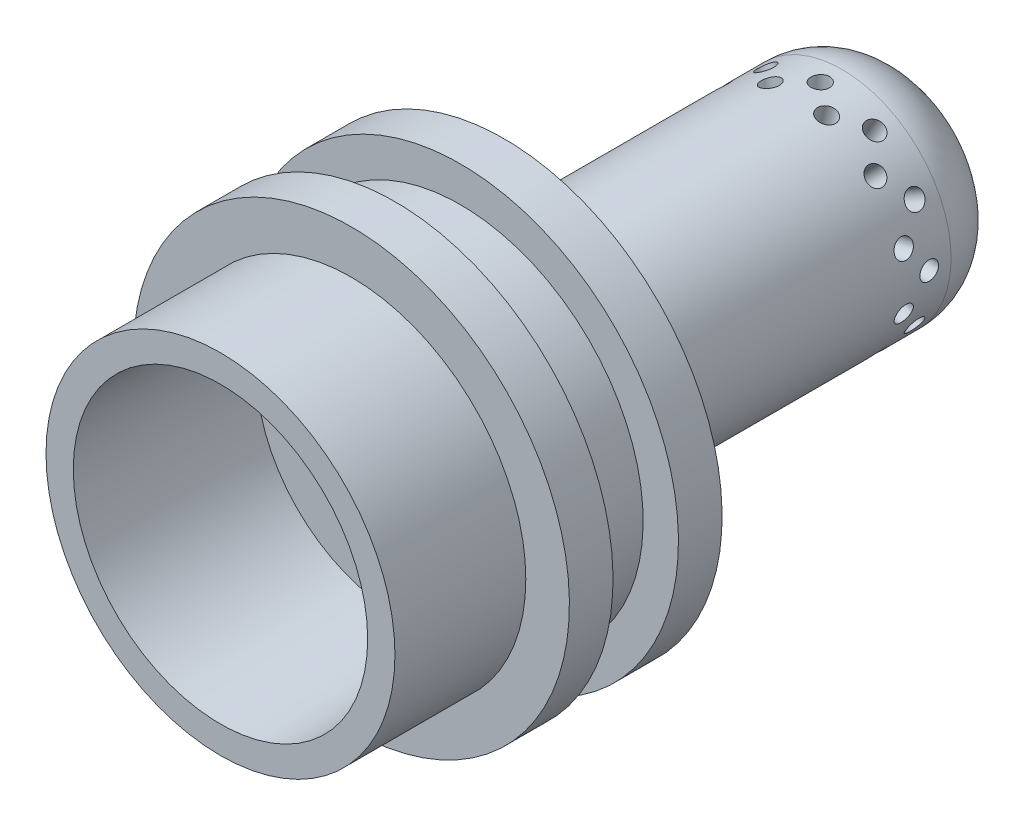
from build123d import *

# Parameters (mm, degrees)
ORIFICE_HOLE_R        = 0.543941
FORWARD_ORIFICE_DEPTH = 31.080506977
SKETCH7_R             = 0.543941
OFFSET_ORIFICE_DEPTH  = 31.080506977
ORIFICE_PATTERN_COUNT = 12
PINTLE_END_FILLET_R   = 3.81
PINTLE_START_FILLET_R = 3.175


# Read off the part's stored shape, not the designer's step: AdvancedHole1
with BuildPart() as part:
    # Sketch2 → Primary Revolve (revolve)
    with BuildSketch(Plane(origin=(0, 0, 0), x_dir=(0, 0, -1), z_dir=(1, 0, 0)), mode=Mode.PRIVATE) as primary_revolve_sk:
        Polygon((-7.62, 12.7), (-10.16, 12.7), (-10.16, 10.6426), (-13.97, 10.6426), (-13.97, 12.7), (-16.51, 12.7), (-16.51, 10.16), (-24.13, 10.16), (-24.13, 0), (15.875, 0), (15.875, 6.35), (-7.62, 6.35), align=None)
    revolve(primary_revolve_sk.sketch.rotate(Axis((0, 0, 24.13), (0, 0, -1)), 180), axis=Axis((0, 0, 24.13), (0, 0, -1)))

    # AdvancedHole1 outline → AdvancedHole1 (revolve, cut)
    with BuildSketch(Plane.XZ):
        Polygon((4.7625, 13.79982), (8.249999615, 13.79982), (8.5725, 24.13), (0, 24.13), (0, -14.2875), (4.7625, -11.425901302), align=None)
    revolve(axis=Axis((0, 0, 0), (0, 0, 1)), mode=Mode.SUBTRACT)

    # Orifice Hole → Forward Orifice (cut, through all)
    with BuildSketch(Plane(origin=(0, 0, 0), x_dir=(1, 0, 0), z_dir=(0, 1, 0))):
        with Locations(Location((0, 10.795, 0), (0, 0, 90))):
            Circle(ORIFICE_HOLE_R)
    forward_orifice = extrude(amount=FORWARD_ORIFICE_DEPTH, mode=Mode.SUBTRACT)

    # Sketch7 → Offset Orifice (cut, through all)
    with BuildSketch(Plane(origin=(0, 0, 0), x_dir=(0, 0, 1), z_dir=(0.25881904510252135, 0.9659258262890681, 0))):
        with Locations(Location((-9.525, 0, 0), (0, 0, 90))):
            Circle(SKETCH7_R)
    offset_orifice = extrude(amount=OFFSET_ORIFICE_DEPTH, mode=Mode.SUBTRACT)

    # Orifice Pattern: Forward Orifice, Offset Orifice ×12 about axis
    orifice_pattern_axis = Axis((0, 0, -16.07764641), (0, 0, 1))
    add([forward_orifice.rotate(orifice_pattern_axis, i * 360 / ORIFICE_PATTERN_COUNT) for i in range(1, ORIFICE_PATTERN_COUNT)], mode=Mode.SUBTRACT)
    add([offset_orifice.rotate(orifice_pattern_axis, i * 360 / ORIFICE_PATTERN_COUNT) for i in range(1, ORIFICE_PATTERN_COUNT)], mode=Mode.SUBTRACT)

    # Pintle End Fillet
    pintle_end_fillet_edges = [part.edges().sort_by_distance(p)[0] for p in [
        (0, 6.35, -15.875),
    ]]
    fillet(pintle_end_fillet_edges, radius=PINTLE_END_FILLET_R)

    # Pintle Start Fillet
    pintle_start_fillet_edges = [part.edges().sort_by_distance(p)[0] for p in [
        (0, 6.35, 7.62),
    ]]
    fillet(pintle_start_fillet_edges, radius=PINTLE_START_FILLET_R)


solid = part.part
